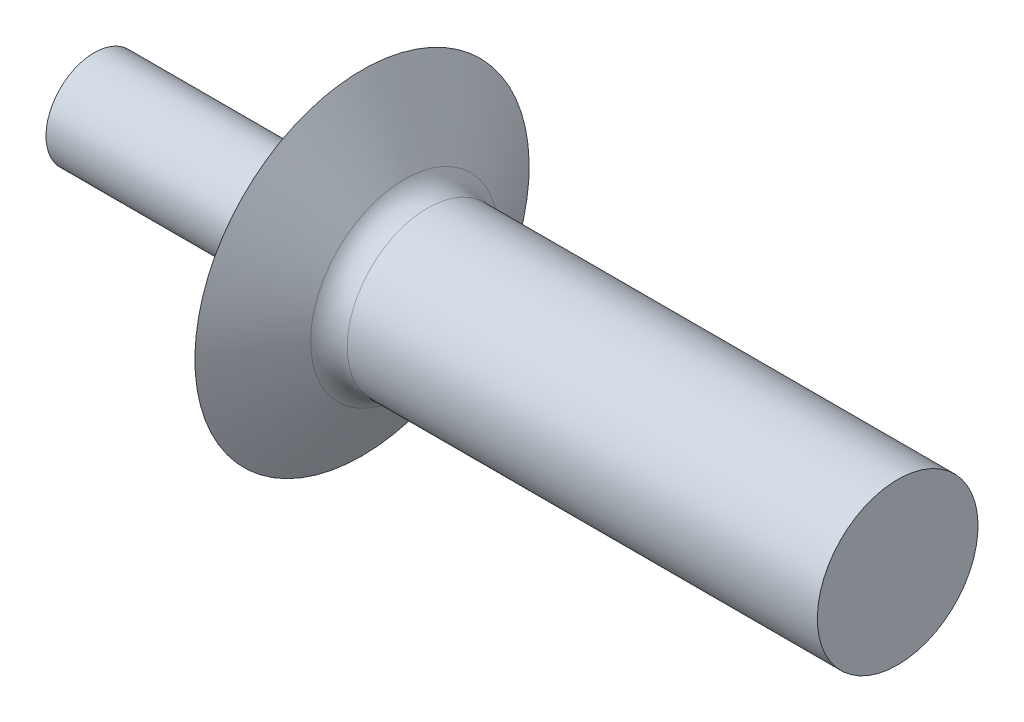
from build123d import *

# Parameters (mm, degrees)
FILLET1_R = 0.5


with BuildPart() as part:
    # Sketch1 → Base-Revolve (revolve)
    with BuildSketch(Plane(origin=(23.915345595, 20.795345595, 0), x_dir=(0, 1, 0), z_dir=(0, 0, 1))):
        Polygon((-20.795345595, 8.915345595), (-19.295345595, 8.915345595), (-19.295345595, 17.980038159), (-17.675345595, 18.915345595), (-19.895345595, 18.915345595), (-19.895345595, 23.915345595), (-20.795345595, 23.915345595), align=None)
    revolve(axis=Axis((-27.254202237, 0, 0), (1, 0, 0)))

    # Fillet1
    fillet1_edges = [part.edges().sort_by_distance(p)[0] for p in [
        (5.935307436, -1.5, 0),
    ]]
    fillet(fillet1_edges, radius=FILLET1_R)


solid = part.part
